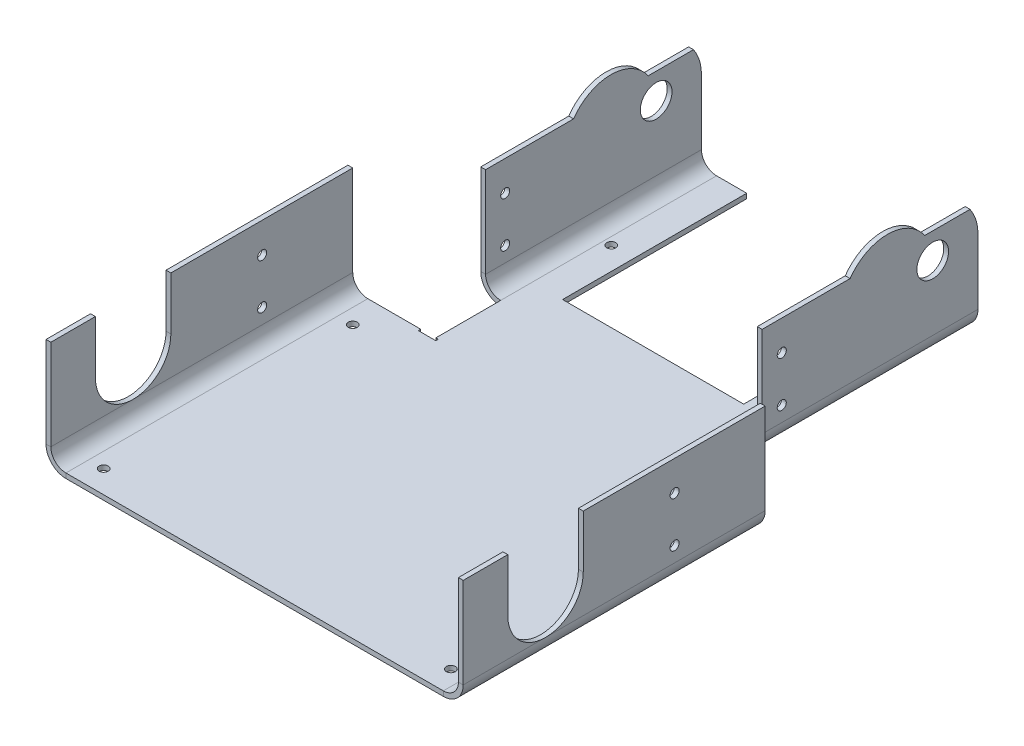
from build123d import *

# Parameters (mm, degrees)
BOSS_EXTRUDE2_DEPTH     = 1.6
EDGE_FLANGE1_START      = -50
EDGE_FLANGE1_DEPTH      = 100
EDGE_FLANGE1_START_2    = -143
EDGE_FLANGE1_2_DEPTH    = 93.8
EDGE_FLANGE1_3_DEPTH    = 0.8
EDGE_FLANGE1_4_DEPTH    = 100
EDGE_FLANGE1_5_DEPTH    = 93
CUT_EXTRUDE1_START      = -71.5
CUT_EXTRUDE1_DEPTH      = 21.5
SKETCH24_R              = 15
BOSS_EXTRUDE3_DEPTH     = 1.6
BOSS_EXTRUDE4_START     = -1.6
SKETCH25_R              = 15
BOSS_EXTRUDE4_DEPTH     = 1.6
SKETCH26_R              = 5.25
CUT_EXTRUDE2_DEPTH      = 109.6
CUT_EXTRUDE3_DEPTH      = 1000
CUT_EXTRUDE4_DEPTH      = 188.95057861
CUT_EXTRUDE4_DEPTH_BACK = 188.95057861
SKETCH30_R              = 1.5
CUT_EXTRUDE5_DEPTH      = 204.484274577
CUT_EXTRUDE5_DEPTH_BACK = 204.484274577
SKETCH32_R              = 1.5
CUT_EXTRUDE6_DEPTH      = 54


# Read off the part's stored shape, not the designer's step: Edge-Flange1, Cut-Extrude1
with BuildPart() as part:
    # Sketch1 → Boss-Extrude2 (new body)
    with BuildSketch(Plane(origin=(0, 0, 0), x_dir=(1, 0, 0), z_dir=(0, 1, 0))):
        Polygon((45, 50), (45, 143), (30, 143), (30, 82), (-30, 82), (-30, 143), (-45, 143), (-45, 50), (-67.5, 50), (-67.5, -50), (67.5, -50), (67.5, 50), align=None)
    extrude(amount=BOSS_EXTRUDE2_DEPTH)

    # Edge-Flange1 outline → Edge-Flange1 (cut)
    with BuildSketch(Plane.XY.offset(EDGE_FLANGE1_START)):
        with BuildLine():
            Line((-67.5, 0), (-62.5, 0))
            ThreePointArc((-62.5, 0), (-64.797825059, 0.412916681), (-66.808131846, 1.6))
            Line((-66.808131846, 1.6), (-67.5, 1.6))
            Line((-67.5, 1.6), (-67.5, 0))
        make_face()
        with BuildLine():
            ThreePointArc((66.808131846, 1.6), (64.797825059, 0.412916681), (62.5, 0))
            Line((62.5, 0), (67.5, 0))
            Line((67.5, 0), (67.5, 1.6))
            Line((67.5, 1.6), (66.808131846, 1.6))
        make_face()
    extrude(amount=EDGE_FLANGE1_DEPTH, mode=Mode.SUBTRACT)

    # Edge-Flange1 2 outline → Edge-Flange1 2 (cut)
    with BuildSketch(Plane.XY.offset(EDGE_FLANGE1_START_2)):
        with BuildLine():
            Line((-45, 1.6), (-45, 0))
            Line((-45, 0), (-40, 0))
            ThreePointArc((-40, 0), (-42.297825059, 0.412916681), (-44.308131846, 1.6))
            Line((-44.308131846, 1.6), (-45, 1.6))
        make_face()
        with BuildLine():
            ThreePointArc((44.308131846, 1.6), (42.297825059, 0.412916681), (40, 0))
            Line((40, 0), (45, 0))
            Line((45, 0), (45, 1.6))
            Line((45, 1.6), (44.308131846, 1.6))
        make_face()
    extrude(amount=EDGE_FLANGE1_2_DEPTH, mode=Mode.SUBTRACT)

    # Edge-Flange1 3 outline → Edge-Flange1 3 (cut)
    with BuildSketch(Plane.XY.offset(EDGE_FLANGE1_START)):
        with BuildLine():
            ThreePointArc((-44.308131846, 1.6), (-42.297825059, 0.412916681), (-40, 0))
            Line((-40, 0), (-39.2, 0))
            Line((-39.2, 0), (-39.2, 1.6))
            Line((-39.2, 1.6), (-44.308131846, 1.6))
        make_face()
        with BuildLine():
            Line((39.2, 1.6), (39.2, 0))
            Line((39.2, 0), (40, 0))
            ThreePointArc((40, 0), (42.297825059, 0.412916681), (44.308131846, 1.6))
            Line((44.308131846, 1.6), (39.2, 1.6))
        make_face()
    extrude(amount=EDGE_FLANGE1_3_DEPTH, mode=Mode.SUBTRACT)

    # Edge-Flange1 4 outline → Edge-Flange1 4 (add)
    with BuildSketch(Plane.XY.offset(EDGE_FLANGE1_START)):
        with BuildLine():
            Line((-66.808131846, 1.6), (-62.5, 1.6))
            ThreePointArc((-62.5, 1.6), (-66.035533906, 3.064466094), (-67.5, 6.6))
            Line((-67.5, 6.6), (-67.5, 36.6))
            Line((-67.5, 36.6), (-69.1, 36.6))
            Line((-69.1, 36.6), (-69.1, 6.6))
            ThreePointArc((-69.1, 6.6), (-68.499736252, 3.84987911), (-66.808131846, 1.6))
        make_face()
        with BuildLine():
            ThreePointArc((67.5, 6.6), (66.035533906, 3.064466094), (62.5, 1.6))
            Line((62.5, 1.6), (66.808131846, 1.6))
            ThreePointArc((66.808131846, 1.6), (68.499736252, 3.84987911), (69.1, 6.6))
            Line((69.1, 6.6), (69.1, 36.6))
            Line((69.1, 36.6), (67.5, 36.6))
            Line((67.5, 36.6), (67.5, 6.6))
        make_face()
    extrude(amount=EDGE_FLANGE1_4_DEPTH)

    # Edge-Flange1 5 outline → Edge-Flange1 5 (add)
    with BuildSketch(Plane.XY.offset(EDGE_FLANGE1_START_2)):
        with BuildLine():
            ThreePointArc((-46.6, 6.6), (-45.999736252, 3.84987911), (-44.308131846, 1.6))
            Line((-44.308131846, 1.6), (-40, 1.6))
            ThreePointArc((-40, 1.6), (-43.535533906, 3.064466094), (-45, 6.6))
            Line((-45, 6.6), (-45, 36.6))
            Line((-45, 36.6), (-46.6, 36.6))
            Line((-46.6, 36.6), (-46.6, 6.6))
        make_face()
        with BuildLine():
            ThreePointArc((45, 6.6), (43.535533906, 3.064466094), (40, 1.6))
            Line((40, 1.6), (44.308131846, 1.6))
            ThreePointArc((44.308131846, 1.6), (45.999736252, 3.84987911), (46.6, 6.6))
            Line((46.6, 6.6), (46.6, 36.6))
            Line((46.6, 36.6), (45, 36.6))
            Line((45, 36.6), (45, 6.6))
        make_face()
    extrude(amount=EDGE_FLANGE1_5_DEPTH)

    # Cut-Extrude1 outline → Cut-Extrude1 (cut)
    with BuildSketch(Plane.XY.offset(CUT_EXTRUDE1_START)):
        with BuildLine():
            ThreePointArc((45, 6.6), (43.535533906, 3.064466094), (40, 1.6))
            Line((40, 1.6), (40, 0))
            ThreePointArc((40, 0), (44.666904756, 1.933095244), (46.6, 6.6))
            Line((46.6, 6.6), (46.6, 36.6))
            Line((46.6, 36.6), (45, 36.6))
            Line((45, 36.6), (45, 6.6))
        make_face()
        with BuildLine():
            ThreePointArc((-46.6, 6.6), (-44.666904756, 1.933095244), (-40, 0))
            Line((-40, 0), (-40, 1.6))
            ThreePointArc((-40, 1.6), (-43.535533906, 3.064466094), (-45, 6.6))
            Line((-45, 6.6), (-45, 36.6))
            Line((-45, 36.6), (-46.6, 36.6))
            Line((-46.6, 36.6), (-46.6, 6.6))
        make_face()
    extrude(amount=CUT_EXTRUDE1_DEPTH, mode=Mode.SUBTRACT)

    # Sketch24 → Boss-Extrude3 (add)
    with BuildSketch(Plane(origin=(46.6, 0, 0), x_dir=(0, 0, -1), z_dir=(1, 0, 0))):
        with Locations((113.002063462, 28.1)):
            Circle(SKETCH24_R)
    extrude(amount=-BOSS_EXTRUDE3_DEPTH)

    # Sketch25 → Boss-Extrude4 (add)
    with BuildSketch(Plane.ZY.offset(46.6).offset(BOSS_EXTRUDE4_START)):
        with Locations((-113.002063462, 28.1)):
            Circle(SKETCH25_R)
    extrude(amount=BOSS_EXTRUDE4_DEPTH)

    # Sketch26 → Cut-Extrude2 (cut)
    with BuildSketch(Plane(origin=(46.6, 0, 0), x_dir=(0, 0, -1), z_dir=(1, 0, 0))):
        with Locations(Location((128.002063462, 28.1, 0), (0, 0, 90))):
            Circle(SKETCH26_R)
        with BuildLine():
            Line((140.361270556, 36.6), (143, 36.6))
            Line((143, 36.6), (143, 28.348796314))
            ThreePointArc((143, 28.348796314), (142.289257641, 32.669035183), (140.361270556, 36.6))
        make_face()
    extrude(amount=-CUT_EXTRUDE2_DEPTH, mode=Mode.SUBTRACT)

    # Sketch27 → Cut-Extrude3 (cut)
    with BuildSketch(Plane(origin=(69.1, 0, 0), x_dir=(0, 0, -1), z_dir=(1, 0, 0))):
        with BuildLine():
            Line((-35.247936633, 19.100000095), (-35.247936633, 36.6))
            Line((-35.247936633, 36.6), (-10.247936633, 36.6))
            Line((-10.247936633, 36.6), (-10.247936633, 19.100000095))
            ThreePointArc((-10.247936633, 19.100000095), (-22.747936633, 6.600000095), (-35.247936633, 19.100000095))
        make_face()
    extrude(amount=-CUT_EXTRUDE3_DEPTH, mode=Mode.SUBTRACT)

    # Sketch30 → Cut-Extrude4 (cut, two sides: drawn at the far end of the back side and taken through both)
    with BuildSketch(Plane(origin=(-45, 0, 0), x_dir=(0, 0, -1), z_dir=(1, 0, 0)).offset(-CUT_EXTRUDE4_DEPTH_BACK)):
        with Locations(Location((78, 26.6, 0), (0, 0, 270))):
            Circle(SKETCH30_R)
        with Locations(Location((78, 11.6, 0), (0, 0, 270))):
            Circle(SKETCH30_R)
    extrude(amount=CUT_EXTRUDE4_DEPTH + CUT_EXTRUDE4_DEPTH_BACK, mode=Mode.SUBTRACT)

    # Sketch31 → Cut-Extrude5 (cut, two sides: drawn at the far end of the back side and taken through both)
    with BuildSketch(Plane(origin=(69.1, 0, 0), x_dir=(0, 0, -1), z_dir=(1, 0, 0)).offset(-CUT_EXTRUDE5_DEPTH_BACK)):
        with BuildLine():
            ThreePointArc((21.5, 26.6), (21.060660172, 27.660660172), (20, 28.1))
            Line((20, 28.1), (20, 25.1))
            ThreePointArc((20, 25.1), (21.060660172, 25.539339828), (21.5, 26.6))
        make_face()
        with BuildLine():
            Line((20, 25.1), (20, 28.1))
            ThreePointArc((20, 28.1), (18.5, 26.6), (20, 25.1))
        make_face()
        with BuildLine():
            ThreePointArc((21.5, 11.6), (21.060660172, 12.660660172), (20, 13.1))
            Line((20, 13.1), (20, 10.1))
            ThreePointArc((20, 10.1), (21.060660172, 10.539339828), (21.5, 11.6))
        make_face()
        with BuildLine():
            Line((20, 10.1), (20, 13.1))
            ThreePointArc((20, 13.1), (18.5, 11.6), (20, 10.1))
        make_face()
    extrude(amount=CUT_EXTRUDE5_DEPTH + CUT_EXTRUDE5_DEPTH_BACK, mode=Mode.SUBTRACT)

    # Sketch32 → Cut-Extrude6 (cut)
    with BuildSketch(Plane(origin=(0, 1.6, 0), x_dir=(1, 0, 0), z_dir=(0, 1, 0))):
        with Locations(Location((37.5, 105.642856368, 0), (0, 0, 270))):
            Circle(SKETCH32_R)
        with Locations(Location((57.5, 40.002063462, 0), (0, 0, 270))):
            Circle(SKETCH32_R)
        with Locations(Location((57.5, -42.497936538, 0), (0, 0, 270))):
            Circle(SKETCH32_R)
        with Locations(Location((-37.5, 105.642856368, 0), (0, 0, 90))):
            Circle(SKETCH32_R)
        with Locations(Location((-57.5, 40.002063462, 0), (0, 0, 90))):
            Circle(SKETCH32_R)
        with Locations(Location((-57.5, -42.497936538, 0), (0, 0, 90))):
            Circle(SKETCH32_R)
    extrude(amount=-CUT_EXTRUDE6_DEPTH, mode=Mode.SUBTRACT)


solid = part.part
